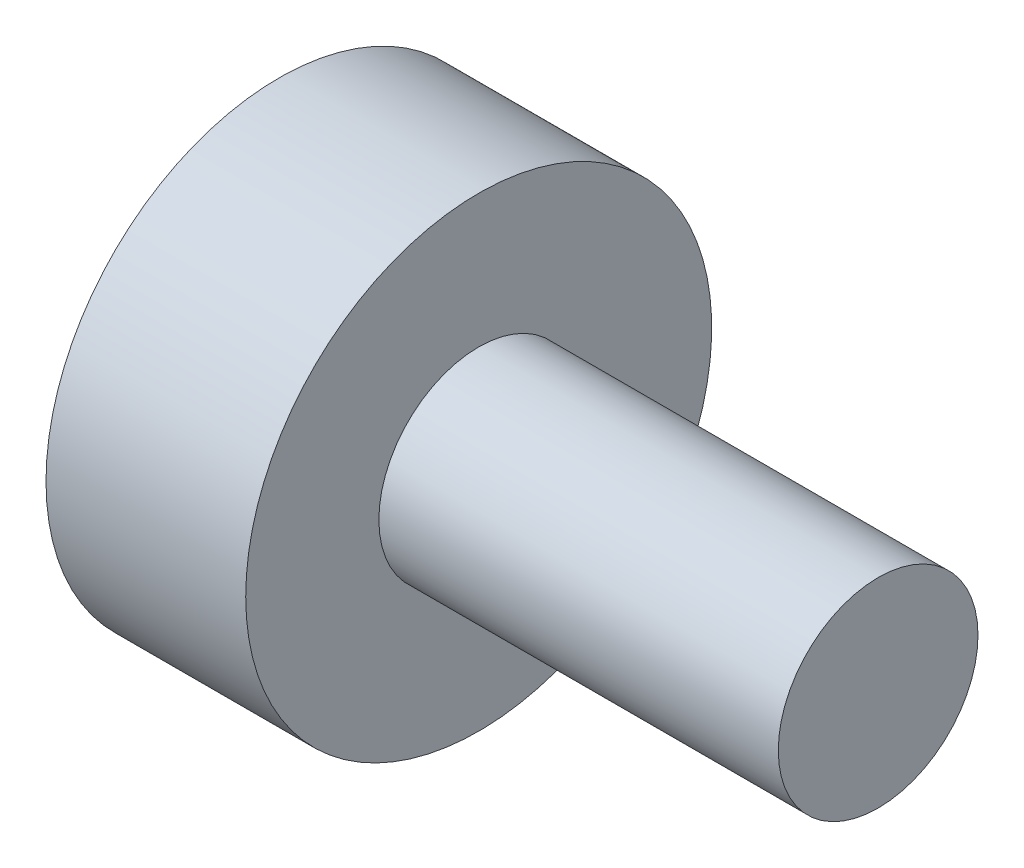
from build123d import *

# Parameters (mm, degrees)
SKETCH_2_R          = 4.25
CUT_EXTRUDE_1_DEPTH = 20
THREAD_1_PITCH      = 1.5


with BuildPart() as part:
    # Sketch 1 → Повернуть1 (revolve)
    with BuildSketch(Plane.XY, mode=Mode.PRIVATE) as revolve_1_sk:
        Polygon((0, 0), (100, 0), (100, 15), (40, 15), (40, 35), (10, 35), (10, 20), (0, 20), align=None)
    revolve(revolve_1_sk.sketch.rotate(Axis((0, 0, 0), (1, 0, 0)), 90), axis=Axis((0, 0, 0), (1, 0, 0)))

    # Эскиз2 → Вырез-Вытянуть1 (cut)
    with BuildSketch(Plane(origin=(0, 0, 0), x_dir=(0, 0, -1), z_dir=(1, 0, 0))):
        Circle(SKETCH_2_R)
    extrude(amount=CUT_EXTRUDE_1_DEPTH, mode=Mode.SUBTRACT)

    # Резьба1: the profile of Sketch 1 2 profile screwed along a right-hand helix of 13.333333 turns, 8 arcs to a turn; built about Z, then put on its axis
    thread_1_z = Axis((0, 0, 0), (0, 0, 1))
    thread_1_corners = [(4.2497, 0, -0.000173205), (5.061898812, 0, 0.468749998), (5.061898812, 0, 0.656249998), (4.2497, 0, 1.125173201)]
    with BuildLine(mode=Mode.PRIVATE) as thread_1_profile:
        Line(thread_1_corners[0], thread_1_corners[1])
        Line(thread_1_corners[1], thread_1_corners[2])
        Line(thread_1_corners[2], thread_1_corners[3])
        Line(thread_1_corners[3], thread_1_corners[0])
    thread_1_cap = Face(thread_1_profile.wire())
    thread_1_turn_angles = [0, 22.5, 45, 67.5, 90, 112.5, 135, 157.5, 180, 202.5, 225, 247.5, 270, 292.5, 315, 337.5, 360]
    thread_1_turn_weights = [1, 0.9238795325112867, 1, 0.9238795325112867, 1, 0.9238795325112867, 1, 0.9238795325112867, 1, 0.9238795325112867, 1, 0.9238795325112867, 1, 0.9238795325112867, 1, 0.9238795325112867, 1]
    thread_1_turn_rails = [Edge.make_bspline([Vector(p[0], p[1], 0).rotate(thread_1_z, thread_1_turn_angles[k]) / thread_1_turn_weights[k] + Vector(0, 0, p[2] + THREAD_1_PITCH * thread_1_turn_angles[k] / 360) for k in range(17)], [0, 0, 0, 1, 1, 2, 2, 3, 3, 4, 4, 5, 5, 6, 6, 7, 7, 8, 8, 8], 2, thread_1_turn_weights) for p in thread_1_corners]
    thread_1_turn_sides = [Face.make_surface_from_curves(thread_1_turn_rails[p[0]], thread_1_turn_rails[p[1]]) for p in [(0, 1), (1, 2), (2, 3), (3, 0)]]
    thread_1_last_angles = [4680, 4702.5, 4725, 4747.5, 4770, 4785, 4800]
    thread_1_last_weights = [1, 0.9238795325112867, 1, 0.9238795325112867, 1, 0.9659258262890703, 1]
    thread_1_last_rails = [Edge.make_bspline([Vector(p[0], p[1], 0).rotate(thread_1_z, thread_1_last_angles[k]) / thread_1_last_weights[k] + Vector(0, 0, p[2] + THREAD_1_PITCH * thread_1_last_angles[k] / 360) for k in range(7)], [0, 0, 0, 1, 1, 2, 2, 3, 3, 3], 2, thread_1_last_weights) for p in thread_1_corners]
    thread_1_last_sides = [Face.make_surface_from_curves(thread_1_last_rails[p[0]], thread_1_last_rails[p[1]]) for p in [(0, 1), (1, 2), (2, 3), (3, 0)]]
    thread_1 = Plane(origin=(0, 0, 0), x_dir=(0, 0, -1), z_dir=(1, 0, 0)) * Solid(Shell([*[p.moved(Location((0, 0, THREAD_1_PITCH * i))) for i in range(13) for p in thread_1_turn_sides], *thread_1_last_sides, thread_1_cap, thread_1_cap.rotate(thread_1_z, 4800).moved(Location((0, 0, THREAD_1_PITCH * 4800 / 360)))]))
    add(thread_1, mode=Mode.SUBTRACT)


solid = part.part
